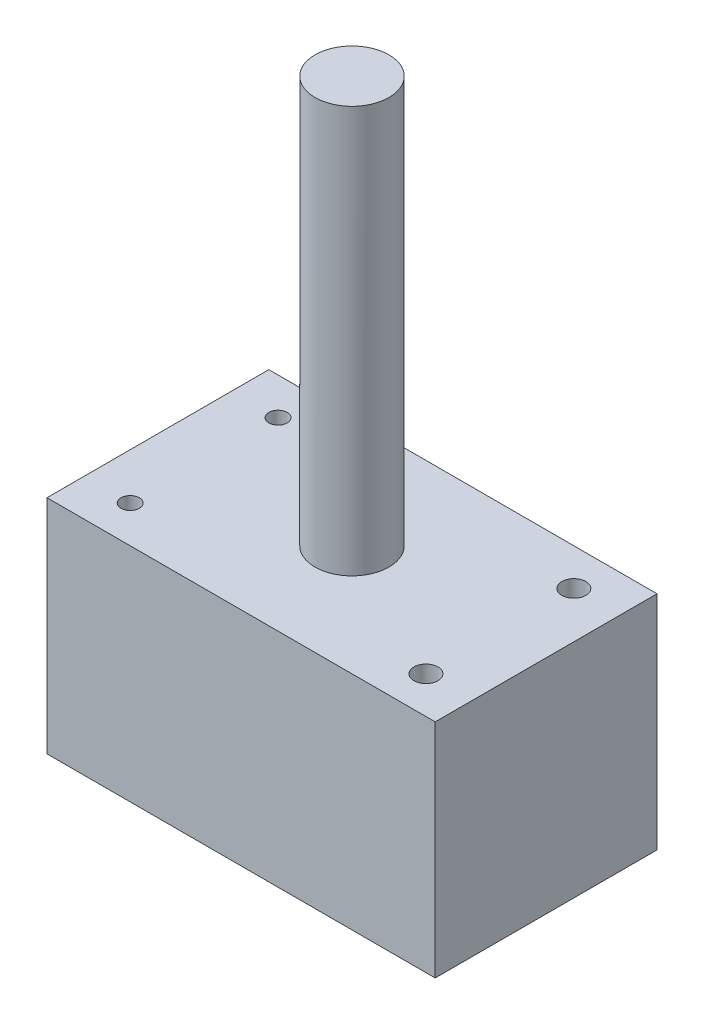
from build123d import *

# Parameters (mm, degrees)
F_01_HOUSING_PROFILE_W      = 105
F_01_HOUSING_PROFILE_H      = 60
F_01_HOUSING_PROFILE_R      = 2.480694692
F_01_HOUSING_PROFILE_R_2    = 3.25
F_01_HOUSING_BLOCK_DEPTH    = 60
F_03_OUTPUT_SHAFT_PROFILE_R = 10
F_03_OUTPUT_SHAFT_DEPTH     = 170


with BuildPart() as part:
    # 01_Housing_Profile → 01_Housing_Block (new body)
    with BuildSketch(Plane(origin=(0, 0, 0), x_dir=(1, 0, 0), z_dir=(0, 1, 0))):
        Rectangle(F_01_HOUSING_PROFILE_W, F_01_HOUSING_PROFILE_H)
        with Locations((-40, -20)):
            Circle(F_01_HOUSING_PROFILE_R, mode=Mode.SUBTRACT)
        with Locations((40, -20)):
            Circle(F_01_HOUSING_PROFILE_R_2, mode=Mode.SUBTRACT)
        with Locations((-40, 20)):
            Circle(F_01_HOUSING_PROFILE_R, mode=Mode.SUBTRACT)
        with Locations((40, 20)):
            Circle(F_01_HOUSING_PROFILE_R_2, mode=Mode.SUBTRACT)
    extrude(amount=F_01_HOUSING_BLOCK_DEPTH)

    # 03_Output_Shaft_Profile → 03_Output_Shaft (add)
    with BuildSketch(Plane(origin=(0, 0, 0), x_dir=(1, 0, 0), z_dir=(0, 1, 0))):
        Circle(F_03_OUTPUT_SHAFT_PROFILE_R)
    extrude(amount=F_03_OUTPUT_SHAFT_DEPTH)


solid = part.part
